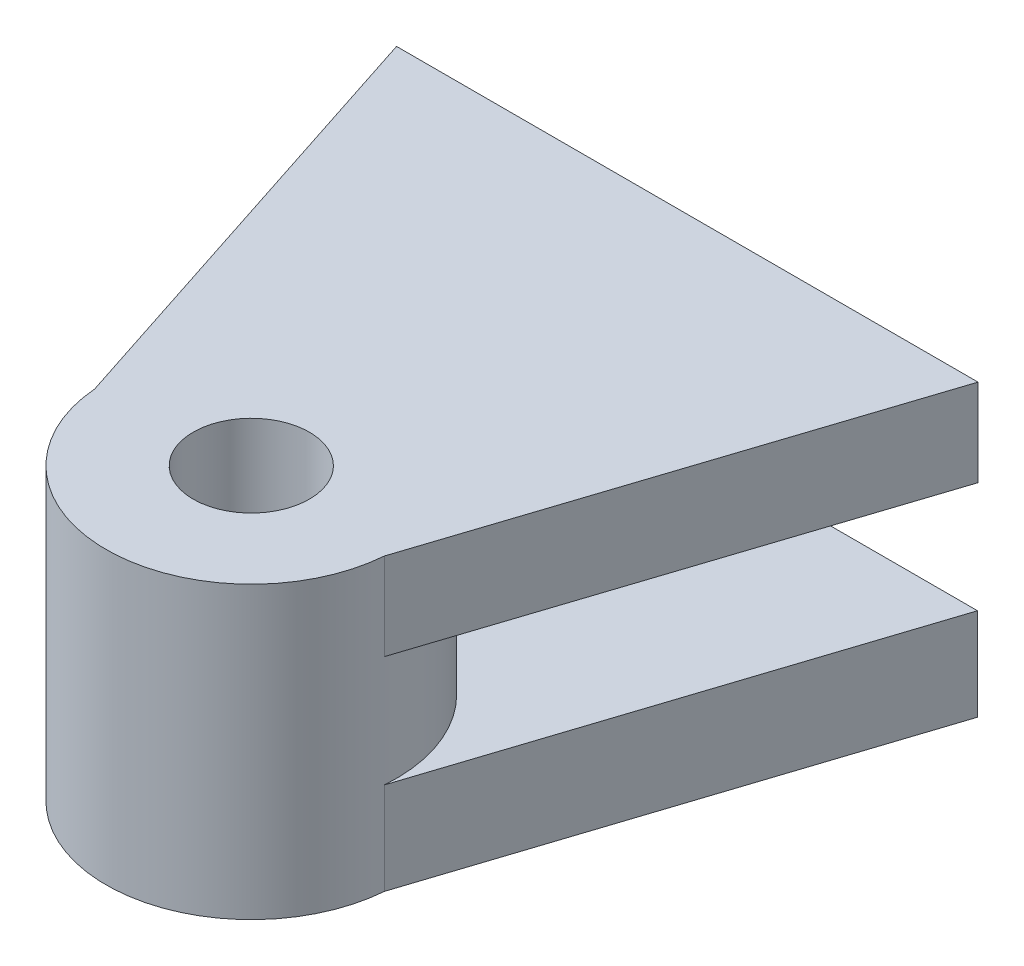
from build123d import *

# Parameters (mm, degrees)
SKETCH1_R           = 4
BOSS_EXTRUDE1_DEPTH = 6.35
SKETCH1_3_R         = 4
BOSS_EXTRUDE2_DEPTH = 20
BOSS_EXTRUDE3_START = -6
SKETCH2_R           = 4
BOSS_EXTRUDE3_DEPTH = 6


with BuildPart() as part:
    # Sketch1 → Boss-Extrude1 (new body)
    with BuildSketch(Plane(origin=(0, 0, 0), x_dir=(1, 0, 0), z_dir=(0, 1, 0))):
        with BuildLine():
            Line((40, 0), (0, 0))
            Line((0, 0), (10.032558322, -30.806291758))
            ThreePointArc((10.032558322, -30.806291758), (20, -40), (29.967441678, -30.806291758))
            Line((29.967441678, -30.806291758), (40, 0))
        make_face()
        with Locations((20, -30)):
            Circle(SKETCH1_R, mode=Mode.SUBTRACT)
    extrude(amount=BOSS_EXTRUDE1_DEPTH)

    # Sketch1<3> → Boss-Extrude2 (add)
    with BuildSketch(Plane(origin=(0, 0, 0), x_dir=(1, 0, 0), z_dir=(0, 1, 0))):
        with BuildLine():
            ThreePointArc((30, -30), (19.596525576, -20.008142896), (10.032558322, -30.806291758))
            ThreePointArc((10.032558322, -30.806291758), (20, -40), (29.967441678, -30.806291758))
            ThreePointArc((29.967441678, -30.806291758), (29.991857104, -30.403474424), (30, -30))
        make_face()
        with Locations((20, -30)):
            Circle(SKETCH1_3_R, mode=Mode.SUBTRACT)
    extrude(amount=BOSS_EXTRUDE2_DEPTH)

    # Sketch2 → Boss-Extrude3 (add)
    with BuildSketch(Plane(origin=(0, 20, 0), x_dir=(1, 0, 0), z_dir=(0, 1, 0)).offset(BOSS_EXTRUDE3_START)):
        with BuildLine():
            Line((40.034175669, 0), (0, 0))
            Line((0, 0), (10.032558322, -30.806291758))
            ThreePointArc((10.032558322, -30.806291758), (20, -40), (29.967441678, -30.806291758))
            Line((29.967441678, -30.806291758), (40.034175669, 0))
        make_face()
        with Locations((20, -30)):
            Circle(SKETCH2_R, mode=Mode.SUBTRACT)
    extrude(amount=BOSS_EXTRUDE3_DEPTH)


solid = part.part
